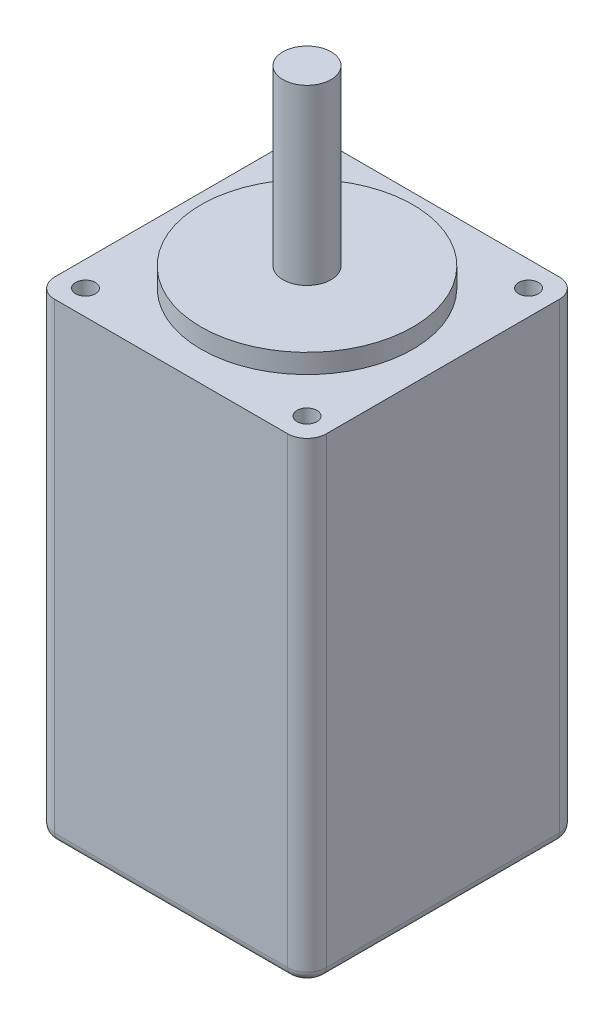
from build123d import *

# Parameters (mm, degrees)
SKETCH1_W                     = 28.2
SKETCH1_H                     = 28.2
BOSS_EXTRUDE1_DEPTH           = 49
SKETCH2_R                     = 11
BOSS_EXTRUDE2_DEPTH           = 2
SKETCH3_R                     = 2.5
BOSS_EXTRUDE3_DEPTH           = 18
FILLET1_R                     = 2
TAP_DRILL_FOR_M2_5_TAP1_D     = 2.05
TAP_DRILL_FOR_M2_5_TAP1_DEPTH = 4.5
TAP_DRILL_FOR_M2_5_TAP1_TIP   = 0.615882135
FILLET2_R                     = 1


with BuildPart() as part:
    # Sketch1 → Boss-Extrude1 (new body)
    with BuildSketch(Plane(origin=(0, 0, 0), x_dir=(1, 0, 0), z_dir=(0, 1, 0))):
        with Locations((14.1, 14.1)):
            Rectangle(SKETCH1_W, SKETCH1_H)
    extrude(amount=BOSS_EXTRUDE1_DEPTH)

    # Sketch2 → Boss-Extrude2 (add)
    with BuildSketch(Plane(origin=(0, 49, 0), x_dir=(1, 0, 0), z_dir=(0, 1, 0))):
        with Locations((14.1, 14.1)):
            Circle(SKETCH2_R)
    extrude(amount=BOSS_EXTRUDE2_DEPTH)

    # Sketch3 → Boss-Extrude3 (add)
    with BuildSketch(Plane(origin=(0, 51, 0), x_dir=(1, 0, 0), z_dir=(0, 1, 0))):
        with Locations((14.1, 14.1)):
            Circle(SKETCH3_R)
    extrude(amount=BOSS_EXTRUDE3_DEPTH)

    # Fillet1
    fillet1_edges = [part.edges().sort_by_distance(p)[0] for p in [
        (28.2, 24.5, -28.2),
        (0, 24.5, -28.2),
        (28.2, 24.5, 0),
        (0, 24.5, 0),
    ]]
    fillet(fillet1_edges, radius=FILLET1_R)

    # Tap Drill for M2.5 Tap1
    with Locations(Plane(origin=(0, 49, 0), x_dir=(1, 0, 0), z_dir=(0, 1, 0))):
        with Locations((2.6, 2.6), (25.6, 2.6), (25.6, 25.6), (2.6, 25.6)):
            Hole(TAP_DRILL_FOR_M2_5_TAP1_D / 2, depth=TAP_DRILL_FOR_M2_5_TAP1_DEPTH)
            with Locations((0, 0, -(TAP_DRILL_FOR_M2_5_TAP1_DEPTH + TAP_DRILL_FOR_M2_5_TAP1_TIP / 2))):  # 118° drill point
                Cone(0, TAP_DRILL_FOR_M2_5_TAP1_D / 2, TAP_DRILL_FOR_M2_5_TAP1_TIP, mode=Mode.SUBTRACT)

    # Fillet2
    fillet2_edges = [part.edges().sort_by_distance(p)[0] for p in [
        (0.585786438, 0, -0.585786438),
        (0, 0, -14.1),
        (0.585786438, 0, -27.614213562),
        (14.1, 0, -28.2),
        (27.614213562, 0, -27.614213562),
        (28.2, 0, -14.1),
        (27.614213562, 0, -0.585786438),
        (14.1, 0, 0),
    ]]
    fillet(fillet2_edges, radius=FILLET2_R)


solid = part.part
